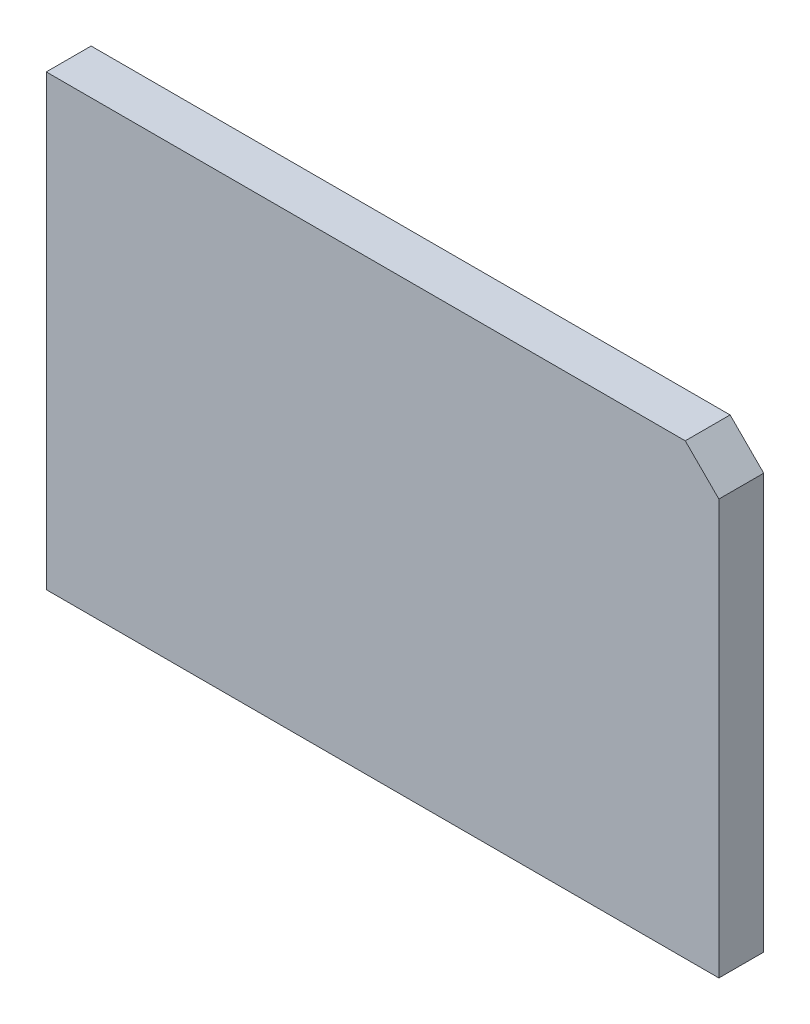
from build123d import *

# Parameters (mm, degrees)
SKETCH1_W           = 1500
SKETCH1_H           = 1000
BOSS_EXTRUDE1_DEPTH = 100
CUT_EXTRUDE1_DEPTH  = 200
SHELL1_T            = -15


with BuildPart() as part:
    # Sketch1 → Boss-Extrude1 (new body)
    with BuildSketch(Plane.XY):
        Rectangle(SKETCH1_W, SKETCH1_H)
    extrude(amount=-BOSS_EXTRUDE1_DEPTH)

    # Sketch2 → Cut-Extrude1 (cut)
    with BuildSketch(Plane.XY):
        Polygon((675, 500), (750, 425), (750, 500), align=None)
    extrude(amount=-CUT_EXTRUDE1_DEPTH, mode=Mode.SUBTRACT)

    # Shell1
    shell1_openings = [part.faces().sort_by_distance(p)[0] for p in [
        (-1.361928616, -0.892298059, -100),
    ]]
    offset(amount=SHELL1_T, openings=shell1_openings, kind=Kind.INTERSECTION)


solid = part.part
